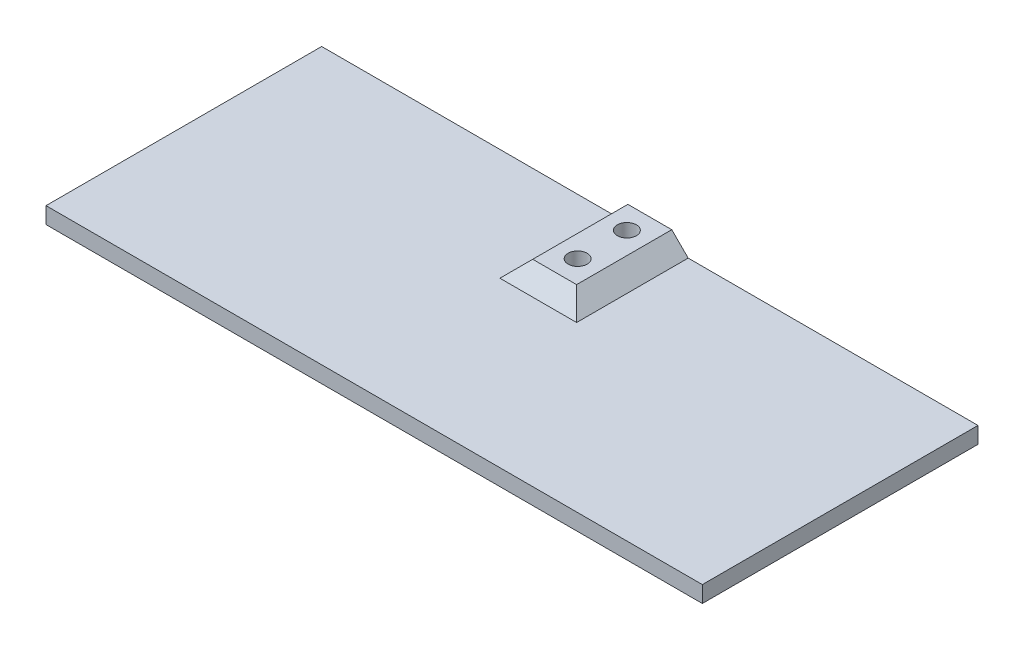
from build123d import *

# Parameters (mm, degrees)
SKETCH2_W                     = 200
SKETCH2_H                     = 84
BOSS_EXTRUDE1_DEPTH           = 5
SKETCH5_W                     = 13.375130616
SKETCH5_H                     = 29
BOSS_EXTRUDE2_DEPTH           = 5
CBORE_FOR_M5_SHCS4_AT_2_COUNT = 2
CBORE_FOR_M5_SHCS4_AT_2_PITCH = 15
CHAMFER1_SIZE                 = 5


with BuildPart() as part:
    # Sketch2 → Boss-Extrude1 (new body)
    with BuildSketch(Plane(origin=(0, 0, 0), x_dir=(1, 0, 0), z_dir=(0, 1, 0))):
        Rectangle(SKETCH2_W, SKETCH2_H)
    extrude(amount=BOSS_EXTRUDE1_DEPTH)

    # Sketch5 → Boss-Extrude2 (add)
    with BuildSketch(Plane(origin=(0, 5, 0), x_dir=(1, 0, 0), z_dir=(0, 1, 0))):
        with Locations((0, 27.5)):
            Rectangle(SKETCH5_W, SKETCH5_H)
    extrude(amount=BOSS_EXTRUDE2_DEPTH)

    # Sketch4 → CBORE for M5 SHCS4 (revolve, cut)
    with BuildSketch(Plane(origin=(0, 0, -20), x_dir=(0, 0, -1), z_dir=(1, 0, 0))):
        Polygon((0, 0), (0, 10), (2.9, 10), (2.9, 5), (5, 5), (5, 0.020977491), (5.025, 0), align=None)
    cbore_for_m5_shcs4 = revolve(axis=Axis((0, -6.35, -20), (0, 1, 0)), mode=Mode.SUBTRACT)

    # CBORE for M5 SHCS4 at 2: CBORE for M5 SHCS4 ×2
    with Locations(*[(0, 0, -i * CBORE_FOR_M5_SHCS4_AT_2_PITCH) for i in range(1, CBORE_FOR_M5_SHCS4_AT_2_COUNT)]):
        add(cbore_for_m5_shcs4, mode=Mode.SUBTRACT)

    # Chamfer1
    chamfer1_edges = [part.edges().sort_by_distance(p)[0] for p in [
        (-6.687565308, 5, -27.5),
        (0, 5, -13),
        (6.687565308, 5, -27.5),
    ]]
    chamfer(chamfer1_edges, length=CHAMFER1_SIZE - 0.0001)  # a hair under: the kernel refuses the full size


solid = part.part
